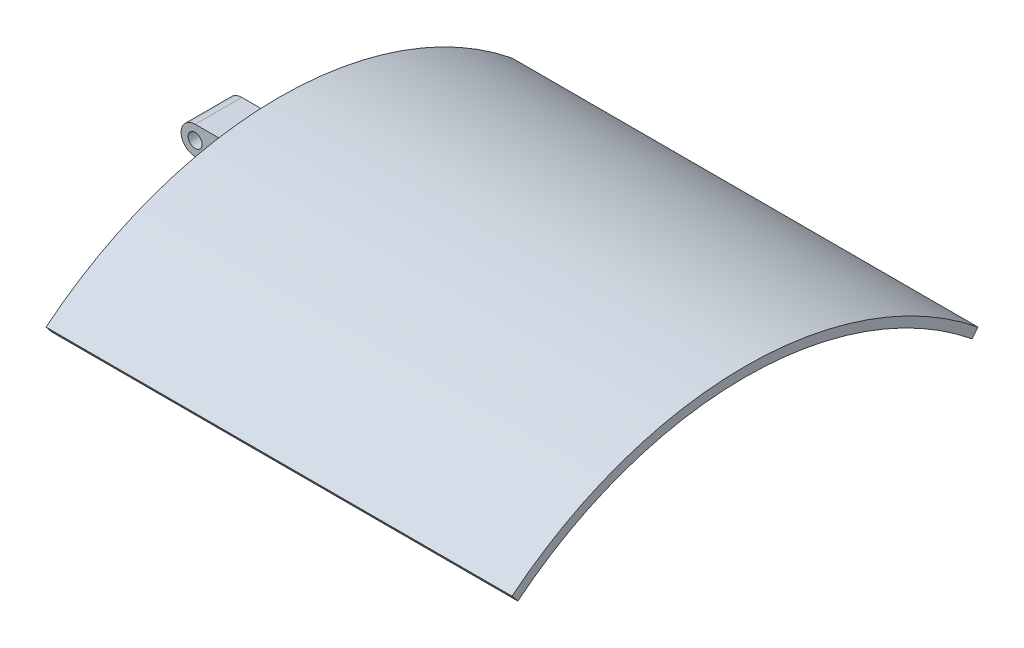
from build123d import *

# Parameters (mm, degrees)
BOSS_EXTRU_1_DEPTH      = 100
BOSS_EXTRU_3_DEPTH      = 5
BOSS_EXTRU_3_DEPTH_BACK = 5
ESQUISSE7_R             = 1.5
BOSS_EXTRU_2_DEPTH      = 3
BOSS_EXTRU_2_DEPTH_BACK = 3
ESQUISSE3_R             = 1.5


with BuildPart() as part:
    # Esquisse1 → Boss.-Extru.1 (new body)
    with BuildSketch(Plane(origin=(0, 0, 0), x_dir=(0, 0, -1), z_dir=(1, 0, 0))):
        with BuildLine():
            Line((-50, 61.808170981), (-48.742138365, 60.25324844))
            ThreePointArc((-48.742138365, 60.25324844), (0, 77.5), (48.742138365, 60.25324844))
            Line((48.742138365, 60.25324844), (50, 61.808170981))
            ThreePointArc((50, 61.808170981), (0, 79.5), (-50, 61.808170981))
        make_face()
    extrude(amount=BOSS_EXTRU_1_DEPTH)

    # Esquisse7 → Boss.-Extru.3 (add, two sides: drawn at the far end of the back side and taken through both)
    with BuildSketch(Plane.XY.offset(-BOSS_EXTRU_3_DEPTH_BACK)):
        with BuildLine():
            Line((7, 77.5), (7, 70.5))
            Line((7, 70.5), (-13, 70.5))
            ThreePointArc((-13, 70.5), (-16, 67.5), (-13, 64.5))
            Line((-13, 64.5), (13, 64.5))
            Line((13, 64.5), (13, 77.5))
            Line((13, 77.5), (7, 77.5))
        make_face()
        with Locations((-13, 67.5)):
            Circle(ESQUISSE7_R, mode=Mode.SUBTRACT)
    extrude(amount=BOSS_EXTRU_3_DEPTH + BOSS_EXTRU_3_DEPTH_BACK)

    # Esquisse3 → Boss.-Extru.2 (add, two sides: drawn at the far end of the back side and taken through both)
    with BuildSketch(Plane.XY.offset(-BOSS_EXTRU_2_DEPTH_BACK)):
        with BuildLine():
            Line((30.72135955, 77.5), (30.72135955, 72.5))
            add(Edge.make_bspline(
                [(30.72135955, 72.5), (30.72135955, 44.694963761), (24.910353183, 46.831964153), (-11, 40.5)],
                knots=[0, 0, 0, 0, 1, 1, 1, 1], degree=3))
            ThreePointArc((-11, 40.5), (-14, 37.5), (-11, 34.5))
            add(Edge.make_bspline(
                [(36.72135955, 72.5), (36.72135955, 41.406516096), (28.397257564, 41.446799475), (-11, 34.5)],
                knots=[0, 0, 0, 0, 1, 1, 1, 1], degree=3))
            Line((36.72135955, 72.5), (36.72135955, 77.5))
            Line((36.72135955, 77.5), (30.72135955, 77.5))
        make_face()
        with Locations((-11, 37.5)):
            Circle(ESQUISSE3_R, mode=Mode.SUBTRACT)
    extrude(amount=BOSS_EXTRU_2_DEPTH + BOSS_EXTRU_2_DEPTH_BACK)


solid = part.part
